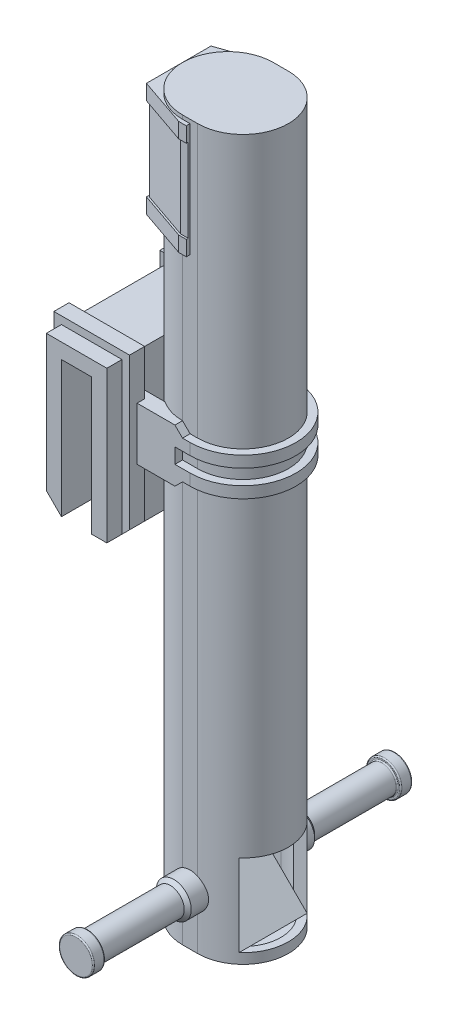
from build123d import *

# Parameters (mm, degrees)
BOSS_EXTRUDE1_DEPTH             = 100
BOSS_EXTRUDE2_START             = -10
BOSS_EXTRUDE2_DEPTH             = 10
SKETCH4_W                       = 10
SKETCH4_H                       = 35
BOSS_EXTRUDE3_DEPTH             = 30
BOSS_EXTRUDE6_REACH             = 143.798
BOSS_EXTRUDE6_DIRECTION_2_REACH = 143.798
BOSS_EXTRUDE7_DEPTH             = 175
BOSS_EXTRUDE7_DEPTH_BACK        = 300
BOSS_EXTRUDE8_START             = -30
BOSS_EXTRUDE8_DEPTH             = 25
CHAMFER2_SIZE                   = 5
CUT_EXTRUDE1_START              = -17.5
CUT_EXTRUDE1_DEPTH              = 5
BOSS_EXTRUDE11_START            = -77.5
BOSS_EXTRUDE11_DEPTH            = 75
CUT_EXTRUDE3_START              = -40
CUT_EXTRUDE3_DEPTH              = 27.5
SKETCH10_W                      = 5
SKETCH10_H                      = 1.25
BOSS_EXTRUDE12_DEPTH            = 55
CUT_EXTRUDE4_START              = -5
CUT_EXTRUDE4_DEPTH              = 465
CUT_EXTRUDE6_START              = 80
SKETCH13_W                      = 22.5
SKETCH13_H                      = 54.178346697
CUT_EXTRUDE6_DEPTH              = 39
BOSS_EXTRUDE13_REACH            = 320.272
CUT_EXTRUDE7_DEPTH              = 72
SCALE1_SCALE                    = 1.3
BOSS_EXTRUDE14_START            = -2.0001
BOSS_EXTRUDE14_DEPTH            = 100.0001
CUT_EXTRUDE8_START              = -80
SKETCH19_R                      = 15
SKETCH19_R_2                    = 12
CUT_EXTRUDE8_DEPTH              = 70
CHAMFER3_SIZE                   = 4
FILLET1_R                       = 1
CHAMFER3_OF_MIRROR9_SIZE        = 4
FILLET1_OF_MIRROR9_R            = 1


# Some blends are built 0.0001 mm under size
with BuildPart() as part:
    # Sketch1 → Boss-Extrude1 (new body)
    with BuildSketch(Plane.XY):
        Polygon((-51.944659521, -77.587364577), (-61.944659521, -67.587364577), (-61.944659521, 22.412635423), (-21.944659521, 22.412635423), (-21.944659521, -77.587364577), (-31.944659521, -77.587364577), (-31.944659521, 12.412635423), (-51.944659521, 12.412635423), align=None)
    extrude(amount=BOSS_EXTRUDE1_DEPTH)

    # Sketch3 → Boss-Extrude2 (add)
    with BuildSketch(Plane.XY.offset(100).offset(BOSS_EXTRUDE2_START)):
        Polygon((-66.944659521, -67.587364577), (-61.944659521, -67.587364577), (-61.944659521, 22.412635423), (-41.273535537, 22.412635423), (-41.273535537, 27.412635423), (-66.944659521, 27.412635423), align=None)
        Polygon((-41.273535537, 27.412635423), (-41.273535537, 22.412635423), (-21.944659521, 22.412635423), (-21.944659521, -33.003930496), (-16.944659521, -33.003930496), (-16.944659521, 27.412635423), align=None)
        Polygon((-16.944659521, -33.003930496), (-21.944659521, -33.003930496), (-21.944659521, -77.587364577), (-16.944659521, -72.587364577), align=None)
    boss_extrude2 = extrude(amount=-BOSS_EXTRUDE2_DEPTH)

    # Mirror1: Boss-Extrude2 across plane
    add(boss_extrude2.mirror(Plane(origin=(0, 0, 50), x_dir=(1, 0, 0), z_dir=(0, 0, -1))))

    # Sketch4 → Boss-Extrude3 (add)
    with BuildSketch(Plane(origin=(-21.944659521, 0, 0), x_dir=(0, 0, -1), z_dir=(1, 0, 0))):
        with Locations((-20, -20.087364577)):
            Rectangle(SKETCH4_W, SKETCH4_H)
        with Locations((-80, -20.087364577)):
            Rectangle(SKETCH4_W, SKETCH4_H)
    extrude(amount=BOSS_EXTRUDE3_DEPTH)

    # Boss-Extrude6: up to this face of the body (flat: up to its plane)
    boss_extrude6_end = Plane(part.part.faces().sort_by_distance((-41.944659521, 22.412635423, 50))[0])
    # Sketch7 → Boss-Extrude6 (add, up to the picked face)
    with BuildSketch(Plane(origin=(0, -2.587364577, 0), x_dir=(1, 0, 0), z_dir=(0, 1, 0)), mode=Mode.PRIVATE) as boss_extrude6_sk1:
        with BuildLine():
            Line((-21.944659521, -59.399178467), (-20.434226807, -59.399178467))
            ThreePointArc((-20.434226807, -59.399178467), (-21.564644485, -54.759883476), (-21.944659521, -50))
            Line((-21.944659521, -50), (-21.944659521, -59.399178467))
        make_face()
    boss_extrude6_tool1 = split(extrude(boss_extrude6_sk1.sketch, amount=BOSS_EXTRUDE6_REACH, mode=Mode.PRIVATE), bisect_by=boss_extrude6_end, keep=Keep.BOTH, mode=Mode.PRIVATE)
    # Sketch7 → Boss-Extrude6 (add, up to the picked face)
    with BuildSketch(Plane(origin=(0, -2.587364577, 0), x_dir=(1, 0, 0), z_dir=(0, 1, 0)), mode=Mode.PRIVATE) as boss_extrude6_sk2:
        with BuildLine():
            ThreePointArc((-21.944659521, -50), (-21.564644485, -45.240116524), (-20.434226807, -40.600821533))
            Line((-20.434226807, -40.600821533), (-21.944659521, -40.600821533))
            Line((-21.944659521, -40.600821533), (-21.944659521, -50))
        make_face()
    boss_extrude6_tool2 = split(extrude(boss_extrude6_sk2.sketch, amount=BOSS_EXTRUDE6_REACH, mode=Mode.PRIVATE), bisect_by=boss_extrude6_end, keep=Keep.BOTH, mode=Mode.PRIVATE)
    # Sketch7 → Boss-Extrude6 (add, up to the picked face)
    with BuildSketch(Plane(origin=(0, -2.587364577, 0), x_dir=(1, 0, 0), z_dir=(0, 1, 0)), mode=Mode.PRIVATE) as boss_extrude6_sk3:
        with BuildLine():
            Line((-20.434226807, -59.399178467), (-20.434226807, -40.600821533))
            ThreePointArc((-20.434226807, -40.600821533), (-21.564644485, -45.240116524), (-21.944659521, -50))
            ThreePointArc((-21.944659521, -50), (-21.564644485, -54.759883476), (-20.434226807, -59.399178467))
        make_face()
    boss_extrude6_tool3 = split(extrude(boss_extrude6_sk3.sketch, amount=BOSS_EXTRUDE6_REACH, mode=Mode.PRIVATE), bisect_by=boss_extrude6_end, keep=Keep.BOTH, mode=Mode.PRIVATE)
    add(boss_extrude6_tool1.solids().sort_by(Axis((-21.493555, -2.587365, 57.061377), (0, 1, 0)))[0])
    add(boss_extrude6_tool2.solids().sort_by(Axis((-21.493555, -2.587365, 42.938623), (0, 1, 0)))[0])
    add(boss_extrude6_tool3.solids().sort_by(Axis((-21.039723, -2.587365, 50), (0, 1, 0)))[0])

    # Boss-Extrude6 direction 2: up to this face of the body (flat: up to its plane)
    boss_extrude6_direction_2_end = Plane(part.part.faces().sort_by_distance((-26.944659521, -77.587364577, 50))[0])
    # Sketch7 → Boss-Extrude6 direction 2 (add, up to the picked face)
    with BuildSketch(Plane(origin=(0, -2.587364577, 0), x_dir=(1, 0, 0), z_dir=(0, 1, 0)), mode=Mode.PRIVATE) as boss_extrude6_direction_2_sk1:
        with BuildLine():
            Line((-21.944659521, -59.399178467), (-20.434226807, -59.399178467))
            ThreePointArc((-20.434226807, -59.399178467), (-21.564644485, -54.759883476), (-21.944659521, -50))
            Line((-21.944659521, -50), (-21.944659521, -59.399178467))
        make_face()
    boss_extrude6_direction_2_tool1 = split(extrude(boss_extrude6_direction_2_sk1.sketch, amount=-BOSS_EXTRUDE6_DIRECTION_2_REACH, mode=Mode.PRIVATE), bisect_by=boss_extrude6_direction_2_end, keep=Keep.BOTH, mode=Mode.PRIVATE)
    # Sketch7 → Boss-Extrude6 direction 2 (add, up to the picked face)
    with BuildSketch(Plane(origin=(0, -2.587364577, 0), x_dir=(1, 0, 0), z_dir=(0, 1, 0)), mode=Mode.PRIVATE) as boss_extrude6_direction_2_sk2:
        with BuildLine():
            ThreePointArc((-21.944659521, -50), (-21.564644485, -45.240116524), (-20.434226807, -40.600821533))
            Line((-20.434226807, -40.600821533), (-21.944659521, -40.600821533))
            Line((-21.944659521, -40.600821533), (-21.944659521, -50))
        make_face()
    boss_extrude6_direction_2_tool2 = split(extrude(boss_extrude6_direction_2_sk2.sketch, amount=-BOSS_EXTRUDE6_DIRECTION_2_REACH, mode=Mode.PRIVATE), bisect_by=boss_extrude6_direction_2_end, keep=Keep.BOTH, mode=Mode.PRIVATE)
    # Sketch7 → Boss-Extrude6 direction 2 (add, up to the picked face)
    with BuildSketch(Plane(origin=(0, -2.587364577, 0), x_dir=(1, 0, 0), z_dir=(0, 1, 0)), mode=Mode.PRIVATE) as boss_extrude6_direction_2_sk3:
        with BuildLine():
            Line((-20.434226807, -59.399178467), (-20.434226807, -40.600821533))
            ThreePointArc((-20.434226807, -40.600821533), (-21.564644485, -45.240116524), (-21.944659521, -50))
            ThreePointArc((-21.944659521, -50), (-21.564644485, -54.759883476), (-20.434226807, -59.399178467))
        make_face()
    boss_extrude6_direction_2_tool3 = split(extrude(boss_extrude6_direction_2_sk3.sketch, amount=-BOSS_EXTRUDE6_DIRECTION_2_REACH, mode=Mode.PRIVATE), bisect_by=boss_extrude6_direction_2_end, keep=Keep.BOTH, mode=Mode.PRIVATE)
    add(boss_extrude6_direction_2_tool1.solids().sort_by(Axis((-21.493555, -2.587365, 57.061377), (0, -1, 0)))[0])
    add(boss_extrude6_direction_2_tool2.solids().sort_by(Axis((-21.493555, -2.587365, 42.938623), (0, -1, 0)))[0])
    add(boss_extrude6_direction_2_tool3.solids().sort_by(Axis((-21.039723, -2.587365, 50), (0, -1, 0)))[0])

    # Sketch7<3> → Boss-Extrude7 (add, two sides: drawn at the far end of the back side and taken through both)
    with BuildSketch(Plane(origin=(0, -2.587364577, 0), x_dir=(1, 0, 0), z_dir=(0, 1, 0)).offset(-BOSS_EXTRUDE7_DEPTH_BACK)):
        with BuildLine():
            Line((8.055340479, -20), (18.055340479, -20))
            ThreePointArc((18.055340479, -20), (48.055340479, -50), (18.055340479, -80))
            Line((18.055340479, -80), (8.055340479, -80))
            ThreePointArc((8.055340479, -80), (-21.944659521, -50), (8.055340479, -20))
        make_face()
    extrude(amount=BOSS_EXTRUDE7_DEPTH + BOSS_EXTRUDE7_DEPTH_BACK)

    # Sketch8 → Boss-Extrude8 (add)
    with BuildSketch(Plane(origin=(0, -2.587364577, 0), x_dir=(1, 0, 0), z_dir=(0, 1, 0)).offset(BOSS_EXTRUDE8_START)):
        with BuildLine():
            Line((18.055340479, -85), (8.055340479, -85))
            Line((8.055340479, -85), (8.055340479, -80))
            Line((8.055340479, -80), (18.055340479, -80))
            ThreePointArc((18.055340479, -80), (48.055340479, -50), (18.055340479, -20))
            Line((18.055340479, -20), (8.055340479, -20))
            Line((8.055340479, -20), (8.055340479, -15))
            Line((8.055340479, -15), (18.055340479, -15))
            ThreePointArc((18.055340479, -15), (53.055340479, -50), (18.055340479, -85))
        make_face()
    extrude(amount=BOSS_EXTRUDE8_DEPTH)

    # Chamfer2
    chamfer2_edges = [part.edges().sort_by_distance(p)[0] for p in [
        (8.055340479, -7.587364577, 17.5),
        (8.055340479, -32.587364577, 17.5),
        (8.055340479, -32.587364577, 82.5),
        (8.055340479, -7.587364577, 82.5),
    ]]
    chamfer(chamfer2_edges, length=CHAMFER2_SIZE - 0.0001)  # a hair under: the kernel refuses the full size

    # Sketch8<2> → Cut-Extrude1 (cut, symmetric)
    with BuildSketch(Plane(origin=(0, -2.587364577, 0), x_dir=(1, 0, 0), z_dir=(0, 1, 0)).offset(CUT_EXTRUDE1_START)):
        with BuildLine():
            Line((18.055340479, -85), (8.055340479, -85))
            Line((8.055340479, -85), (8.055340479, -80))
            Line((8.055340479, -80), (18.055340479, -80))
            ThreePointArc((18.055340479, -80), (48.055340479, -50), (18.055340479, -20))
            Line((18.055340479, -20), (8.055340479, -20))
            Line((8.055340479, -20), (8.055340479, -15))
            Line((8.055340479, -15), (18.055340479, -15))
            ThreePointArc((18.055340479, -15), (53.055340479, -50), (18.055340479, -85))
        make_face()
    extrude(amount=CUT_EXTRUDE1_DEPTH, both=True, mode=Mode.SUBTRACT)

    # Sketch9 → Boss-Extrude11 (add)
    with BuildSketch(Plane(origin=(0, 172.412635423, 0), x_dir=(1, 0, 0), z_dir=(0, 1, 0)).offset(BOSS_EXTRUDE11_START)):
        Polygon((-21.944659521, -40.600821533), (-21.944659521, -30.300410767), (-21.944659521, -27.800410767), (-24.444659521, -28.658778331), (-24.444659521, -71.341221669), (-21.944659521, -72.199589233), (-21.944659521, -69.699589233), (-21.944659521, -59.399178467), (-21.944659521, -49.999999954), align=None)
        with BuildLine():
            ThreePointArc((-21.944659521, -49.999999954), (-21.564644482, -45.240116501), (-20.434226807, -40.600821533))
            Line((-20.434226807, -40.600821533), (-21.944659521, -40.600821533))
            Line((-21.944659521, -40.600821533), (-21.944659521, -49.999999954))
        make_face()
        with BuildLine():
            ThreePointArc((-20.434226807, -59.399178467), (-21.564644489, -54.759883453), (-21.944659521, -49.999999954))
            Line((-21.944659521, -49.999999954), (-21.944659521, -59.399178467))
            Line((-21.944659521, -59.399178467), (-20.434226807, -59.399178467))
        make_face()
        with BuildLine():
            ThreePointArc((-10.37301428, -26.327320793), (-1.686826215, -21.62588877), (8.055340479, -20))
            Line((8.055340479, -20), (13.055340479, -20))
            Line((13.055340479, -20), (13.055340479, -17.5))
            Line((13.055340479, -17.5), (8.055340479, -17.5))
            Line((8.055340479, -17.5), (-21.944659521, -27.800410767))
            Line((-21.944659521, -27.800410767), (-21.944659521, -30.300410767))
            Line((-21.944659521, -30.300410767), (-10.37301428, -26.327320793))
        make_face()
        with BuildLine():
            Line((13.055340479, -80), (8.055340479, -80))
            ThreePointArc((8.055340479, -80), (-1.686826215, -78.37411123), (-10.37301428, -73.672679207))
            Line((-10.37301428, -73.672679207), (-21.944659521, -69.699589233))
            Line((-21.944659521, -69.699589233), (-21.944659521, -72.199589233))
            Line((-21.944659521, -72.199589233), (8.055340479, -82.5))
            Line((8.055340479, -82.5), (13.055340479, -82.5))
            Line((13.055340479, -82.5), (13.055340479, -80))
        make_face()
        with BuildLine():
            ThreePointArc((-10.37301428, -73.672679207), (-1.686826215, -78.37411123), (8.055340479, -80))
            Line((8.055340479, -80), (-10.37301428, -73.672679207))
        make_face()
        with BuildLine():
            ThreePointArc((-20.434226807, -40.600821533), (-16.465182723, -32.715789232), (-10.37301428, -26.327320793))
            Line((-10.37301428, -26.327320793), (-21.944659521, -30.300410767))
            Line((-21.944659521, -30.300410767), (-21.944659521, -40.600821533))
            Line((-21.944659521, -40.600821533), (-20.434226807, -40.600821533))
        make_face()
        with BuildLine():
            Line((-21.944659521, -69.699589233), (-10.37301428, -73.672679207))
            ThreePointArc((-10.37301428, -73.672679207), (-16.465182723, -67.284210768), (-20.434226807, -59.399178467))
            Line((-20.434226807, -59.399178467), (-21.944659521, -59.399178467))
            Line((-21.944659521, -59.399178467), (-21.944659521, -69.699589233))
        make_face()
    extrude(amount=BOSS_EXTRUDE11_DEPTH)

    # Sketch9<4> → Cut-Extrude3 (cut, symmetric)
    with BuildSketch(Plane(origin=(0, 172.412635423, 0), x_dir=(1, 0, 0), z_dir=(0, 1, 0)).offset(CUT_EXTRUDE3_START)):
        with BuildLine():
            ThreePointArc((-10.37301428, -26.327320793), (-1.686826215, -21.62588877), (8.055340479, -20))
            Line((8.055340479, -20), (13.055340479, -20))
            Line((13.055340479, -20), (13.055340479, -17.5))
            Line((13.055340479, -17.5), (8.055340479, -17.5))
            Line((8.055340479, -17.5), (-21.944659521, -27.800410767))
            Line((-21.944659521, -27.800410767), (-21.944659521, -30.300410767))
            Line((-21.944659521, -30.300410767), (-10.37301428, -26.327320793))
        make_face()
        Polygon((-21.944659521, -40.600821533), (-21.944659521, -30.300410767), (-21.944659521, -27.800410767), (-24.444659521, -28.658778331), (-24.444659521, -71.341221669), (-21.944659521, -72.199589233), (-21.944659521, -69.699589233), (-21.944659521, -59.399178467), (-21.944659521, -49.999999954), align=None)
        with BuildLine():
            ThreePointArc((-20.434226807, -40.600821533), (-16.465182723, -32.715789232), (-10.37301428, -26.327320793))
            Line((-10.37301428, -26.327320793), (-21.944659521, -30.300410767))
            Line((-21.944659521, -30.300410767), (-21.944659521, -40.600821533))
            Line((-21.944659521, -40.600821533), (-20.434226807, -40.600821533))
        make_face()
        with BuildLine():
            ThreePointArc((-20.434226807, -59.399178467), (-21.564644489, -54.759883453), (-21.944659521, -49.999999954))
            Line((-21.944659521, -49.999999954), (-21.944659521, -59.399178467))
            Line((-21.944659521, -59.399178467), (-20.434226807, -59.399178467))
        make_face()
        with BuildLine():
            ThreePointArc((-21.944659521, -49.999999954), (-21.564644482, -45.240116501), (-20.434226807, -40.600821533))
            Line((-20.434226807, -40.600821533), (-21.944659521, -40.600821533))
            Line((-21.944659521, -40.600821533), (-21.944659521, -49.999999954))
        make_face()
        with BuildLine():
            Line((-21.944659521, -69.699589233), (-10.37301428, -73.672679207))
            ThreePointArc((-10.37301428, -73.672679207), (-16.465182723, -67.284210768), (-20.434226807, -59.399178467))
            Line((-20.434226807, -59.399178467), (-21.944659521, -59.399178467))
            Line((-21.944659521, -59.399178467), (-21.944659521, -69.699589233))
        make_face()
        with BuildLine():
            Line((13.055340479, -80), (8.055340479, -80))
            ThreePointArc((8.055340479, -80), (-1.686826215, -78.37411123), (-10.37301428, -73.672679207))
            Line((-10.37301428, -73.672679207), (-21.944659521, -69.699589233))
            Line((-21.944659521, -69.699589233), (-21.944659521, -72.199589233))
            Line((-21.944659521, -72.199589233), (8.055340479, -82.5))
            Line((8.055340479, -82.5), (13.055340479, -82.5))
            Line((13.055340479, -82.5), (13.055340479, -80))
        make_face()
        with BuildLine():
            Line((-10.37301428, -26.327320793), (8.055340479, -20))
            ThreePointArc((8.055340479, -20), (-1.686826215, -21.62588877), (-10.37301428, -26.327320793))
        make_face()
        with BuildLine():
            ThreePointArc((-10.37301428, -73.672679207), (-1.686826215, -78.37411123), (8.055340479, -80))
            Line((8.055340479, -80), (-10.37301428, -73.672679207))
        make_face()
    extrude(amount=CUT_EXTRUDE3_DEPTH, both=True, mode=Mode.SUBTRACT)

    # Sketch10 → Boss-Extrude12 (add)
    with BuildSketch(Plane(origin=(0, 104.912635423, 0), x_dir=(1, 0, 0), z_dir=(0, 1, 0))):
        with BuildLine():
            Line((8.055340479, -20), (8.055340479, -18.75))
            Line((8.055340479, -18.75), (-23.194659521, -29.479594549))
            Line((-23.194659521, -29.479594549), (-23.194659521, -33.036931295))
            Line((-23.194659521, -33.036931295), (-23.194659521, -70.520405451))
            Line((-23.194659521, -70.520405451), (8.055340479, -81.25))
            Line((8.055340479, -81.25), (8.055340479, -80))
            Line((8.055340479, -80), (-10.37301428, -73.672679207))
            ThreePointArc((-10.37301428, -73.672679207), (-21.944659521, -50), (-10.37301428, -26.327320793))
            Line((-10.37301428, -26.327320793), (8.055340479, -20))
        make_face()
        with BuildLine():
            Line((13.055340479, -20), (8.055340479, -20))
            Line((8.055340479, -20), (-10.37301428, -26.327320793))
            ThreePointArc((-10.37301428, -26.327320793), (-21.944659521, -50), (-10.37301428, -73.672679207))
            Line((-10.37301428, -73.672679207), (8.055340479, -80))
            Line((8.055340479, -80), (13.055340479, -80))
            Line((13.055340479, -80), (13.055340479, -20))
        make_face()
        with Locations((10.555340479, -19.375)):
            Rectangle(SKETCH10_W, SKETCH10_H)
        with Locations((10.555340479, -80.625)):
            Rectangle(SKETCH10_W, SKETCH10_H)
    extrude(amount=BOSS_EXTRUDE12_DEPTH)

    # Sketch11 → Cut-Extrude4 (cut)
    with BuildSketch(Plane(origin=(0, 172.412635423, 0), x_dir=(1, 0, 0), z_dir=(0, 1, 0)).offset(CUT_EXTRUDE4_START)):
        with BuildLine():
            Line((8.055340479, -25), (18.055340479, -25))
            ThreePointArc((18.055340479, -25), (43.055340479, -50), (18.055340479, -75))
            Line((18.055340479, -75), (8.055340479, -75))
            ThreePointArc((8.055340479, -75), (-16.944659521, -50), (8.055340479, -25))
        make_face()
    extrude(amount=-CUT_EXTRUDE4_DEPTH, mode=Mode.SUBTRACT)

    # Sketch13 → Cut-Extrude6 (cut)
    with BuildSketch(Plane(origin=(-21.944659521, 0, 0), x_dir=(0, 0, -1), z_dir=(1, 0, 0)).offset(CUT_EXTRUDE6_START)):
        with Locations((-61.25, -268.767626444)):
            Rectangle(SKETCH13_W, SKETCH13_H)
        with Locations((-38.75, -268.767626444)):
            Rectangle(SKETCH13_W, SKETCH13_H)
    extrude(amount=-CUT_EXTRUDE6_DEPTH, mode=Mode.SUBTRACT)

    # Boss-Extrude13: up to this face of the body (flat: up to its plane)
    boss_extrude13_end = Plane(part.part.faces().sort_by_distance((33.425531575, -268.767626444, 72.5))[0])
    # Sketch15 → Boss-Extrude13 (add, up to the picked face)
    with BuildSketch(Plane.XY.offset(27.5), mode=Mode.PRIVATE) as boss_extrude13_sk1:
        Polygon((37.898475312, -295.856799792), (-16.944659521, -241.013664959), (-16.944659521, -246.894936278), (32.017203993, -295.856799792), align=None)
    boss_extrude13_tool1 = split(extrude(boss_extrude13_sk1.sketch, amount=BOSS_EXTRUDE13_REACH, mode=Mode.PRIVATE), bisect_by=boss_extrude13_end, keep=Keep.BOTH, mode=Mode.PRIVATE)
    add(boss_extrude13_tool1.solids().sort_by(Axis((9.034358, -269.877782, 27.5), (0, 0, 1)))[0])

    # Sketch16 → Cut-Extrude7 (cut)
    with BuildSketch(Plane.XZ.offset(302.587364577)):
        with BuildLine():
            Line((-16.944659521, 72.5), (-16.944659521, 66.583123952))
            ThreePointArc((-16.944659521, 66.583123952), (-14.560561912, 69.710935012), (-11.787794354, 72.5))
            Line((-11.787794354, 72.5), (-16.944659521, 72.5))
        make_face()
        with BuildLine():
            Line((-16.944659521, 27.5), (-16.944659521, 33.416876048))
            ThreePointArc((-16.944659521, 33.416876048), (-14.560561912, 30.289064988), (-11.787794354, 27.5))
            Line((-11.787794354, 27.5), (-16.944659521, 27.5))
        make_face()
    extrude(amount=-CUT_EXTRUDE7_DEPTH, mode=Mode.SUBTRACT)


with BuildPart() as part_1:
    # Scale1: scaled about (-5.504651419, -44.634312061, 50)
    add(part.part.scale(SCALE1_SCALE).moved(Location((1.651395426, 13.390293618, -15))))

    # Sketch17 → Boss-Extrude14 (add)
    with BuildSketch(Plane(origin=(0, 0, 10.999975893), x_dir=(-1, 0, 0), z_dir=(0, 0, -1)).offset(BOSS_EXTRUDE14_START)):
        with BuildLine():
            Line((-25.123337675, -322.489116532), (-25.123337675, -336.007622367))
            Line((-25.123337675, -336.007622367), (-12.123337675, -336.007622367))
            Line((-12.123337675, -336.007622367), (-12.123337675, -322.489116532))
            ThreePointArc((-12.123337675, -322.489116532), (-18.623337675, -321.007622367), (-25.123337675, -322.489116532))
        make_face()
        with BuildLine():
            Line((-12.123337675, -336.007622367), (-25.123337675, -336.007622367))
            Line((-25.123337675, -336.007622367), (-25.123337675, -349.526128201))
            ThreePointArc((-25.123337675, -349.526128201), (-18.623337675, -351.007622367), (-12.123337675, -349.526128201))
            Line((-12.123337675, -349.526128201), (-12.123337675, -336.007622367))
        make_face()
        with BuildLine():
            Line((-25.123337675, -349.526128201), (-25.123337675, -336.007622367))
            Line((-25.123337675, -336.007622367), (-25.123337675, -322.489116532))
            ThreePointArc((-25.123337675, -322.489116532), (-33.623337675, -336.007622367), (-25.123337675, -349.526128201))
        make_face()
        with BuildLine():
            Line((-12.123337675, -322.489116532), (-12.123337675, -336.007622367))
            Line((-12.123337675, -336.007622367), (-12.123337675, -349.526128201))
            ThreePointArc((-12.123337675, -349.526128201), (-5.924912576, -343.991982078), (-3.623337675, -336.007622367))
            ThreePointArc((-3.623337675, -336.007622367), (-5.924912576, -328.023262656), (-12.123337675, -322.489116532))
        make_face()
    boss_extrude14 = extrude(amount=BOSS_EXTRUDE14_DEPTH)

    # Sketch19 → Cut-Extrude8 (cut)
    with BuildSketch(Plane(origin=(0, 0, -87.000024107), x_dir=(-1, 0, 0), z_dir=(0, 0, -1)).offset(CUT_EXTRUDE8_START)):
        with Locations((-18.623337675, -336.007622367)):
            Circle(SKETCH19_R)
        with Locations((-18.623337675, -336.007622367)):
            Circle(SKETCH19_R_2, mode=Mode.SUBTRACT)
    cut_extrude8 = extrude(amount=CUT_EXTRUDE8_DEPTH, mode=Mode.SUBTRACT)

    # Chamfer3
    # the kernel refuses this chamfer: 4 mm, written as the material it takes off along each edge
    with BuildSketch(Plane(origin=(18.623337675, -336.007622367, -7.000024107), x_dir=(-0.4333333333333214, -0.9012337223063908, 0), z_dir=(-0.9012337223063908, 0.4333333333333214, 0))) as chamfer3_piece_1_section:
        Polygon((15, CHAMFER3_SIZE), (15 - CHAMFER3_SIZE, 0), (15, 0), align=None)
    chamfer3_piece_1 = revolve(axis=Axis((18.623337675, -336.007622367, -7.000024107), (0, 0, 1)), mode=Mode.PRIVATE)
    chamfer3_piece_1 = chamfer3_piece_1 - Plane(origin=(18.623337675, -336.007622367, -4.50648888), x_dir=(-1, 0, 0), z_dir=(0, 0, 1)) * Cylinder(12, 61, mode=Mode.PRIVATE)
    add(chamfer3_piece_1, mode=Mode.SUBTRACT)

    # Fillet1
    fillet1_edges = [part_1.edges().sort_by_distance(p)[0] for p in [
        (25.123337675, -322.489116532, -87.000024107),
        (25.123337675, -322.489116532, -77.000024107),
        (30.623337675, -336.007622367, -77.000024107),
    ]]
    fillet(fillet1_edges, radius=FILLET1_R)

    # Mirror9: Boss-Extrude14, Cut-Extrude8 across plane
    add(boss_extrude14.mirror(Plane(origin=(0, 0, 49.999975893), x_dir=(1, 0, 0), z_dir=(0, 0, -1))))
    add(cut_extrude8.mirror(Plane(origin=(0, 0, 49.999975893), x_dir=(1, 0, 0), z_dir=(0, 0, -1))), mode=Mode.SUBTRACT)

    # Chamfer3 of Mirror9
    # the kernel refuses this chamfer: 4 mm, written as the material it takes off along each edge
    with BuildSketch(Plane(origin=(18.623337675, -336.007622367, 106.999975893), x_dir=(-0.43333333333332563, -0.9012337223063887, 1.8947806286935926e-15), z_dir=(0.9012337223063887, -0.43333333333332563, -2.396659593990197e-15))) as chamfer3_of_mirror9_piece_1_section:
        Polygon((15, CHAMFER3_OF_MIRROR9_SIZE), (15 - CHAMFER3_OF_MIRROR9_SIZE, 0), (15, 0), align=None)
    chamfer3_of_mirror9_piece_1 = revolve(axis=Axis((18.623337675, -336.007622367, 106.999975893), (0, 0, -1)), mode=Mode.PRIVATE)
    chamfer3_of_mirror9_piece_1 = chamfer3_of_mirror9_piece_1 - Plane(origin=(18.623337675, -336.007622367, 104.506440665), x_dir=(-1, 0, 0), z_dir=(0, 0, -1)) * Cylinder(12, 61, mode=Mode.PRIVATE)
    add(chamfer3_of_mirror9_piece_1, mode=Mode.SUBTRACT)

    # Fillet1 of Mirror9
    fillet1_of_mirror9_edges = [part_1.edges().sort_by_distance(p)[0] for p in [
        (25.123337675, -322.489116532, 186.999975893),
        (25.123337675, -322.489116532, 176.999975893),
        (30.623337675, -336.007622367, 176.999975893),
    ]]
    fillet(fillet1_of_mirror9_edges, radius=FILLET1_OF_MIRROR9_R)


solid = part_1.part
